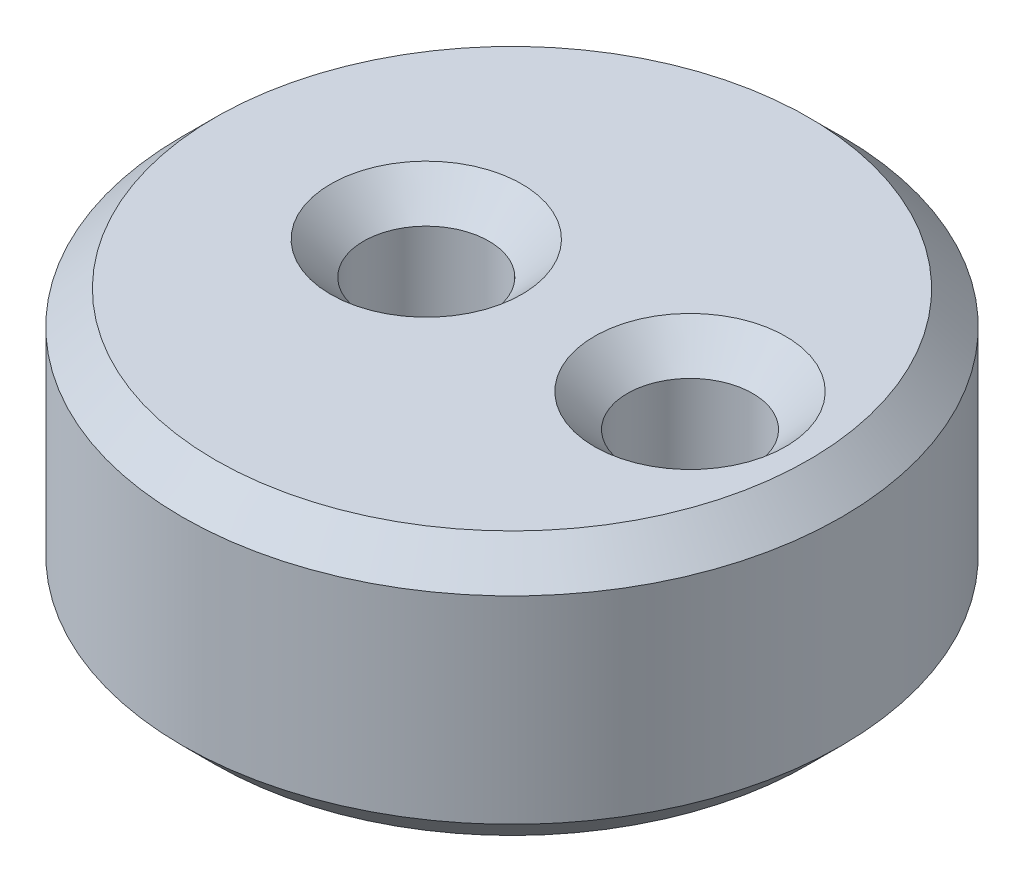
from build123d import *

# Parameters (mm, degrees)
SKETCH_1_R      = 5
SKETCH_1_R_2    = 0.95
EXTRUDE_1_DEPTH = 4
CHAMFER_1_SIZE  = 0.5


with BuildPart() as part:
    # 草图1 → 凸台-拉伸1 (new body)
    with BuildSketch(Plane(origin=(0, 0, 0), x_dir=(1, 0, 0), z_dir=(0, 1, 0))):
        Circle(SKETCH_1_R)
        with Locations((2.7, 0)):
            Circle(SKETCH_1_R_2, mode=Mode.SUBTRACT)
        with Locations((-1.3, 0)):
            Circle(SKETCH_1_R_2, mode=Mode.SUBTRACT)
    extrude(amount=EXTRUDE_1_DEPTH)

    # 倒角1
    chamfer_1_edges = [part.edges().sort_by_distance(p)[0] for p in [
        (-5, 0, 0),
        (-5, 4, 0),
        (-2.25, 0, 0),
        (1.75, 0, 0),
        (-2.25, 4, 0),
        (1.75, 4, 0),
    ]]
    chamfer(chamfer_1_edges, length=CHAMFER_1_SIZE)


solid = part.part
